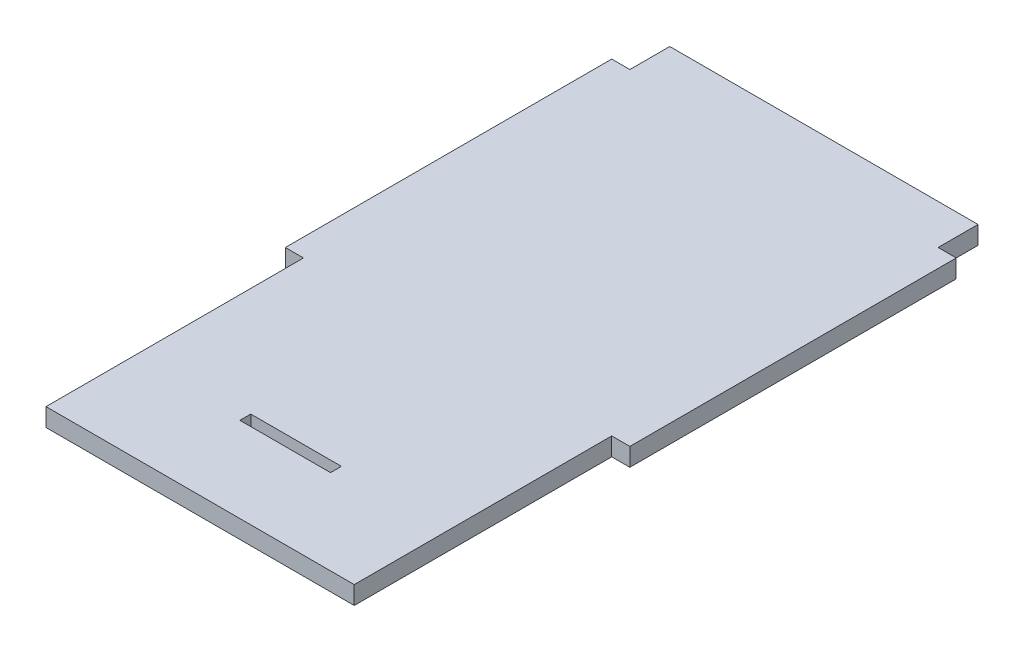
from build123d import *

# Parameters (mm, degrees)
CROQUIS1_W              = 25
CROQUIS1_H              = 3
SALIENTE_EXTRUIR1_DEPTH = 5


with BuildPart() as part:
    # Croquis1 → Saliente-Extruir1 (new body)
    with BuildSketch(Plane(origin=(0, 0, 0), x_dir=(1, 0, 0), z_dir=(0, 1, 0))):
        Polygon((-42.5, -86), (42.5, -86), (42.5, -15), (47.5, -15), (47.5, 75), (42.5, 75), (42.5, 86), (-42.5, 86), (-42.5, 75), (-47.5, 75), (-47.5, -15), (-42.5, -15), align=None)
        with Locations((0, -61.039633263)):
            Rectangle(CROQUIS1_W, CROQUIS1_H, mode=Mode.SUBTRACT)
    extrude(amount=SALIENTE_EXTRUIR1_DEPTH)


solid = part.part
